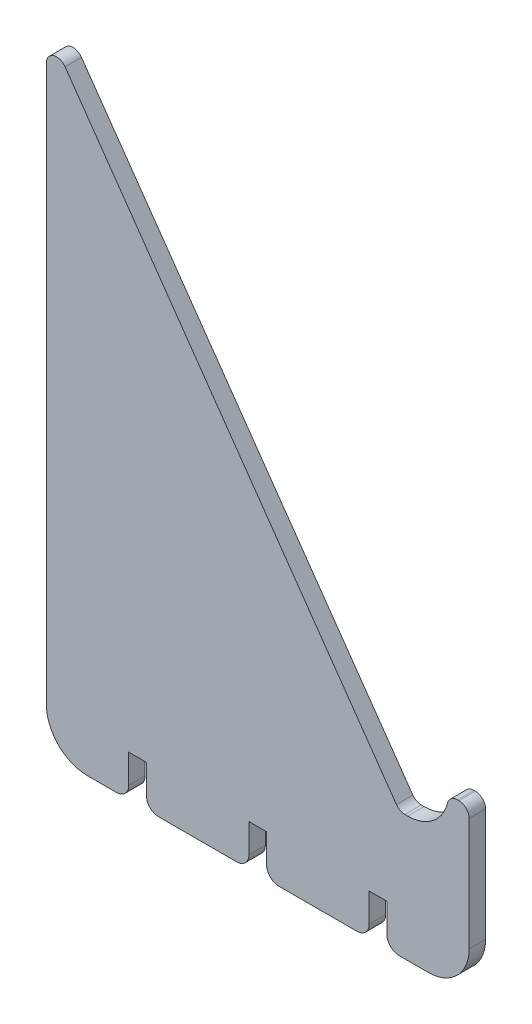
from build123d import *

# Parameters (mm, degrees)
BOSS_EXTRUDE1_DEPTH = 4
SKETCH3_W           = 4.3
SKETCH3_H           = 10
CUT_EXTRUDE1_DEPTH  = 191.936440256
FILLET1_R           = 3


with BuildPart() as part:
    # Sketch1 → Boss-Extrude1 (new body)
    with BuildSketch(Plane.XY):
        with BuildLine():
            Line((86.496300823, -131.179339344), (85.797718449, -131.179339344))
            ThreePointArc((85.797718449, -131.179339344), (84.643346916, -130.896866427), (83.749838339, -130.113280435))
            Line((83.749838339, -130.113280435), (3.007715481, -14.801578616))
            ThreePointArc((3.007715481, -14.801578616), (0.208070871, -13.85122733), (-1.54016463, -16.235519707))
            Line((-1.54016463, -16.235519707), (-1.54016463, -151.684305639))
            ThreePointArc((-1.54016463, -151.684305639), (1.388767558, -158.75537345), (8.45983537, -161.684305639))
            Line((8.45983537, -161.684305639), (91.483543137, -161.684305639))
            ThreePointArc((91.483543137, -161.684305639), (98.554610949, -158.75537345), (101.483543137, -151.684305639))
            Line((101.483543137, -151.684305639), (101.483543137, -124.184305639))
            ThreePointArc((101.483543137, -124.184305639), (100.75131009, -122.416538686), (98.983543137, -121.684305639))
            Line((98.983543137, -121.684305639), (98.629733048, -121.684305639))
            ThreePointArc((98.629733048, -121.684305639), (97.08903242, -122.215488335), (96.203046603, -123.58331238))
            ThreePointArc((96.203046603, -123.58331238), (92.659103337, -129.054608557), (86.496300823, -131.179339344))
        make_face()
    extrude(amount=BOSS_EXTRUDE1_DEPTH)

    # Sketch3 → Cut-Extrude1 (cut, through all)
    with BuildSketch(Plane(origin=(0, 0, 0), x_dir=(-1, 0, 0), z_dir=(0, 0, -1))):
        with Locations((-49.971689254, -156.684305639)):
            Rectangle(SKETCH3_W, SKETCH3_H)
        with Locations((-20.671689254, -156.684305639)):
            Rectangle(SKETCH3_W, SKETCH3_H)
        with Locations((-79.271689254, -156.684305639)):
            Rectangle(SKETCH3_W, SKETCH3_H)
    extrude(amount=-CUT_EXTRUDE1_DEPTH, mode=Mode.SUBTRACT)

    # Fillet1
    fillet1_edges = [part.edges().sort_by_distance(p)[0] for p in [
        (18.521689254, -161.684305639, 2),
        (22.821689254, -161.684305639, 2),
        (47.821689254, -161.684305639, 2),
        (52.121689254, -161.684305639, 2),
        (77.121689254, -161.684305639, 2),
        (81.421689254, -161.684305639, 2),
    ]]
    fillet(fillet1_edges, radius=FILLET1_R)


solid = part.part
